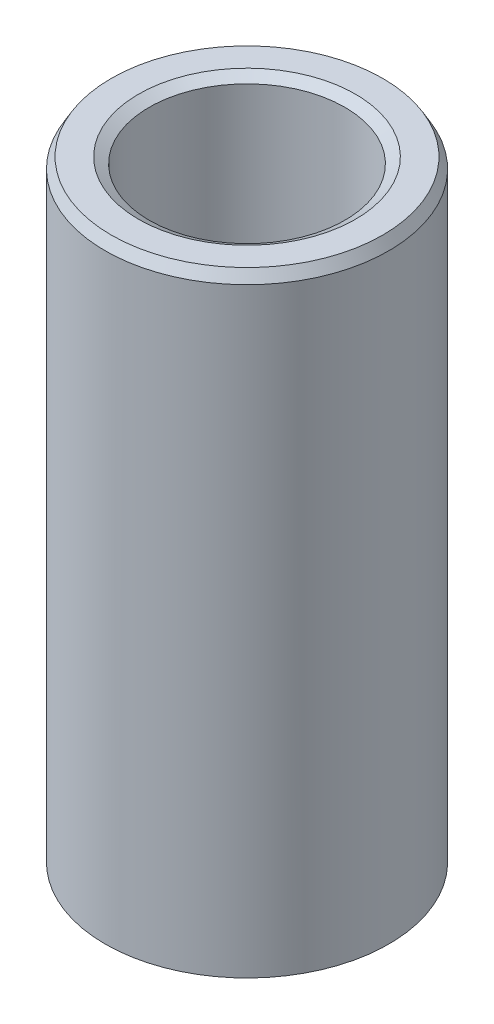
from build123d import *
from OCP.BRepFilletAPI import BRepFilletAPI_MakeChamfer

# Parameters (mm, degrees)
SKETCH1_R           = 40
BOSS_EXTRUDE1_DEPTH = 174.011662587
SKETCH2_R           = 27.605712311
CUT_EXTRUDE1_DEPTH  = 183.975568632
CHAMFER1_SIZE       = 2.977628463
CHAMFER1_SIZE2      = 1.719134595


with BuildPart() as part:
    # Sketch1 → Boss-Extrude1 (new body)
    with BuildSketch(Plane(origin=(0, 0, 0), x_dir=(1, 0, 0), z_dir=(0, 1, 0))):
        Circle(SKETCH1_R)
    extrude(amount=BOSS_EXTRUDE1_DEPTH)

    # Sketch2 → Cut-Extrude1 (cut, through all)
    with BuildSketch(Plane(origin=(0, 0, 0), x_dir=(1, 0, 0), z_dir=(0, 1, 0))):
        Circle(SKETCH2_R)
    extrude(amount=CUT_EXTRUDE1_DEPTH, mode=Mode.SUBTRACT)

    # Chamfer1: one chamfer whose edges measure the first distance from different faces: ONE call of the kernel's chamfer builder (chamfer() names one face for all edges)
    chamfer1_edges_1 = [part.edges().sort_by_distance(p)[0] for p in [
        (-27.605712311, 174.011662587, 0),
    ]]
    chamfer1_side_1 = [part.faces().sort_by_distance(p)[0] for p in [
        (-38.86862915, 174.011662587, 0),
    ]]
    chamfer1_edges_2 = [part.edges().sort_by_distance(p)[0] for p in [
        (-27.605712311, 0, 0),
    ]]
    chamfer1_side_2 = [part.faces().sort_by_distance(p)[0] for p in [
        (-27.605712311, 87.005831294, 0),
    ]]
    chamfer1_edges_3 = [part.edges().sort_by_distance(p)[0] for p in [
        (-40, 0, 0),
    ]]
    chamfer1_side_3 = [part.faces().sort_by_distance(p)[0] for p in [
        (-38.86862915, 0, 0),
    ]]
    chamfer1_edges_4 = [part.edges().sort_by_distance(p)[0] for p in [
        (-40, 174.011662587, 0),
    ]]
    chamfer1_side_4 = [part.faces().sort_by_distance(p)[0] for p in [
        (-40, 87.005831294, 0),
    ]]
    chamfer1 = BRepFilletAPI_MakeChamfer(part.part.solid().wrapped)
    for e in chamfer1_edges_1:
        chamfer1.Add(CHAMFER1_SIZE, CHAMFER1_SIZE2, e.wrapped, chamfer1_side_1[0].wrapped)  # the first distance lies on this face
    for e in chamfer1_edges_2:
        chamfer1.Add(CHAMFER1_SIZE, CHAMFER1_SIZE2, e.wrapped, chamfer1_side_2[0].wrapped)  # the first distance lies on this face
    for e in chamfer1_edges_3:
        chamfer1.Add(CHAMFER1_SIZE, CHAMFER1_SIZE2, e.wrapped, chamfer1_side_3[0].wrapped)  # the first distance lies on this face
    for e in chamfer1_edges_4:
        chamfer1.Add(CHAMFER1_SIZE, CHAMFER1_SIZE2, e.wrapped, chamfer1_side_4[0].wrapped)  # the first distance lies on this face
    add(Compound.cast(chamfer1.Shape()), mode=Mode.REPLACE)


solid = part.part
